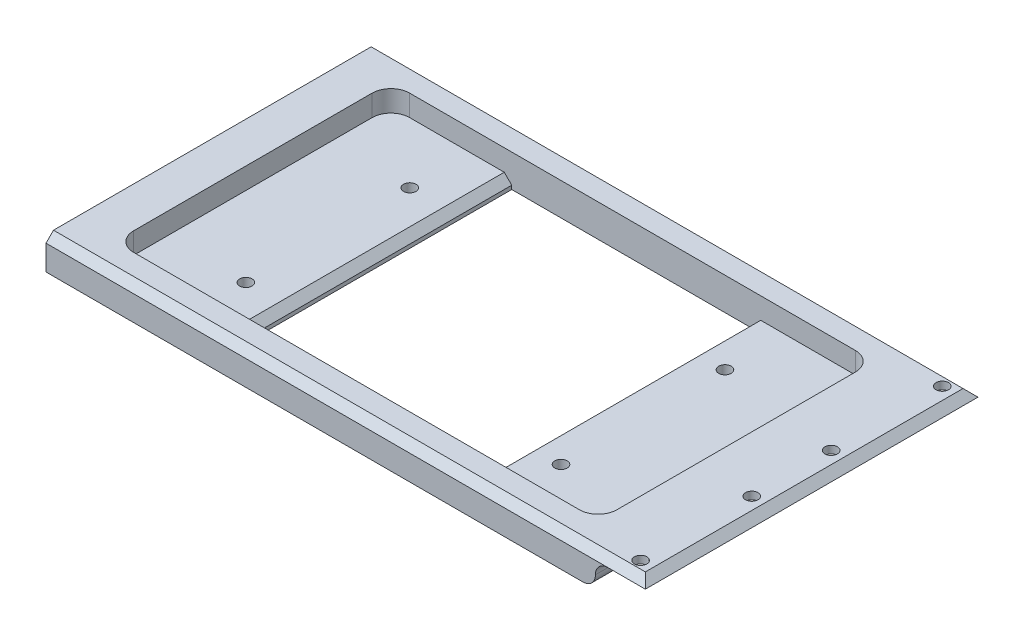
from build123d import *

# Parameters (mm, degrees)
SKETCH1_W                        = 240
SKETCH1_H                        = 133.2
BOSS_EXTRUDE1_DEPTH              = 13
CUT_EXTRUDE1_DEPTH               = 8.5
F_1_8_27_NPSM_TAPPED_HOLE1_D     = 5
F_1_8_27_NPSM_TAPPED_HOLE1_DEPTH = 22.99
F_1_8_27_NPSM_TAPPED_HOLE1_TIP   = 1.502151548
SKETCH6_W                        = 96.703687768
SKETCH6_H                        = 110.5
CUT_EXTRUDE2_DEPTH               = 144.655177421
SKETCH32_W                       = 20
SKETCH32_H                       = 133.2
CUT_EXTRUDE10_DEPTH              = 10
FILLET1_START                    = -68
FILLET1_DEPTH                    = 136
FILLET1_START_2                  = -66.6
FILLET1_2_DEPTH                  = 133.2
M6X1_0_TAPPED_HOLE1_D            = 5
M6X1_0_TAPPED_HOLE1_DEPTH        = 15
M6X1_0_TAPPED_HOLE1_TIP          = 1.502151548
CHAMFER1_SIZE                    = 3


with BuildPart() as part:
    # Sketch1 → Boss-Extrude1 (new body)
    with BuildSketch(Plane(origin=(0, 0, 0), x_dir=(1, 0, 0), z_dir=(0, 1, 0))):
        with Locations((7, 0)):
            Rectangle(SKETCH1_W, SKETCH1_H)
    extrude(amount=BOSS_EXTRUDE1_DEPTH)

    # Sketch2 → Cut-Extrude1 (cut)
    with BuildSketch(Plane(origin=(0, 13, 0), x_dir=(1, 0, 0), z_dir=(0, 1, 0))):
        with BuildLine():
            Line((-89.25, 55.25), (89.25, 55.25))
            ThreePointArc((89.25, 55.25), (94.553300859, 53.053300859), (96.75, 47.75))
            Line((96.75, 47.75), (96.75, -47.75))
            ThreePointArc((96.75, -47.75), (94.553300859, -53.053300859), (89.25, -55.25))
            Line((89.25, -55.25), (-89.25, -55.25))
            ThreePointArc((-89.25, -55.25), (-94.553300859, -53.053300859), (-96.75, -47.75))
            Line((-96.75, -47.75), (-96.75, 47.75))
            ThreePointArc((-96.75, 47.75), (-94.553300859, 53.053300859), (-89.25, 55.25))
        make_face()
    extrude(amount=-CUT_EXTRUDE1_DEPTH, mode=Mode.SUBTRACT)

    # 1/8-27 NPSM Tapped Hole1
    with Locations(Plane(origin=(0, 4.5, 0), x_dir=(1, 0, 0), z_dir=(0, 1, 0))):
        with Locations((-64.86, 30.93), (61.34, 30.93), (61.34, -34.72), (-64.86, -34.72)):
            Hole(F_1_8_27_NPSM_TAPPED_HOLE1_D / 2, depth=F_1_8_27_NPSM_TAPPED_HOLE1_DEPTH)
            with Locations((0, 0, -(F_1_8_27_NPSM_TAPPED_HOLE1_DEPTH + F_1_8_27_NPSM_TAPPED_HOLE1_TIP / 2))):  # 118° drill point
                Cone(0, F_1_8_27_NPSM_TAPPED_HOLE1_D / 2, F_1_8_27_NPSM_TAPPED_HOLE1_TIP, mode=Mode.SUBTRACT)

    # Sketch6 → Cut-Extrude2 (cut, through all)
    with BuildSketch(Plane(origin=(0, 4.5, 0), x_dir=(1, 0, 0), z_dir=(0, 1, 0))):
        Rectangle(SKETCH6_W, SKETCH6_H)
    extrude(amount=-CUT_EXTRUDE2_DEPTH, mode=Mode.SUBTRACT)

    # Sketch32 → Cut-Extrude10 (cut)
    with BuildSketch(Plane.XZ):
        with Locations((117, 0)):
            Rectangle(SKETCH32_W, SKETCH32_H)
    extrude(amount=-CUT_EXTRUDE10_DEPTH, mode=Mode.SUBTRACT)

    # Fillet1: read off the stored shape, not the designer's step
    # Fillet1 outline → Fillet1 (cut)
    with BuildSketch(Plane.XY.offset(FILLET1_START)):
        with BuildLine():
            Line((107, 0), (107, 5))
            ThreePointArc((107, 5), (105.535533906, 1.464466094), (102, 0))
            Line((102, 0), (107, 0))
        make_face()
    extrude(amount=FILLET1_DEPTH, mode=Mode.SUBTRACT)

    # Fillet1 2 outline → Fillet1 2 (add)
    with BuildSketch(Plane.XY.offset(FILLET1_START_2)):
        with BuildLine():
            ThreePointArc((107, 5), (108.464466094, 8.535533906), (112, 10))
            Line((112, 10), (107, 10))
            Line((107, 10), (107, 5))
        make_face()
    extrude(amount=FILLET1_2_DEPTH)

    # M6x1.0 Tapped Hole1
    with Locations(Plane(origin=(0, 13, 0), x_dir=(1, 0, 0), z_dir=(0, 1, 0))):
        with Locations((119.05, 60.25), (119.05, 15.75), (119.05, -16.05), (119.05, -60.55)):
            Hole(M6X1_0_TAPPED_HOLE1_D / 2, depth=M6X1_0_TAPPED_HOLE1_DEPTH)
            with Locations((0, 0, -(M6X1_0_TAPPED_HOLE1_DEPTH + M6X1_0_TAPPED_HOLE1_TIP / 2))):  # 118° drill point
                Cone(0, M6X1_0_TAPPED_HOLE1_D / 2, M6X1_0_TAPPED_HOLE1_TIP, mode=Mode.SUBTRACT)

    # Chamfer1
    chamfer1_edges = [part.edges().sort_by_distance(p)[0] for p in [
        (7, 13, 66.6),
        (127, 13, 0),
        (7, 13, -66.6),
        (48.351843884, 4.5, 0),
        (-48.351843884, 4.5, 0),
    ]]
    chamfer(chamfer1_edges, length=CHAMFER1_SIZE - 0.0001)  # a hair under: the kernel refuses the full size


solid = part.part
